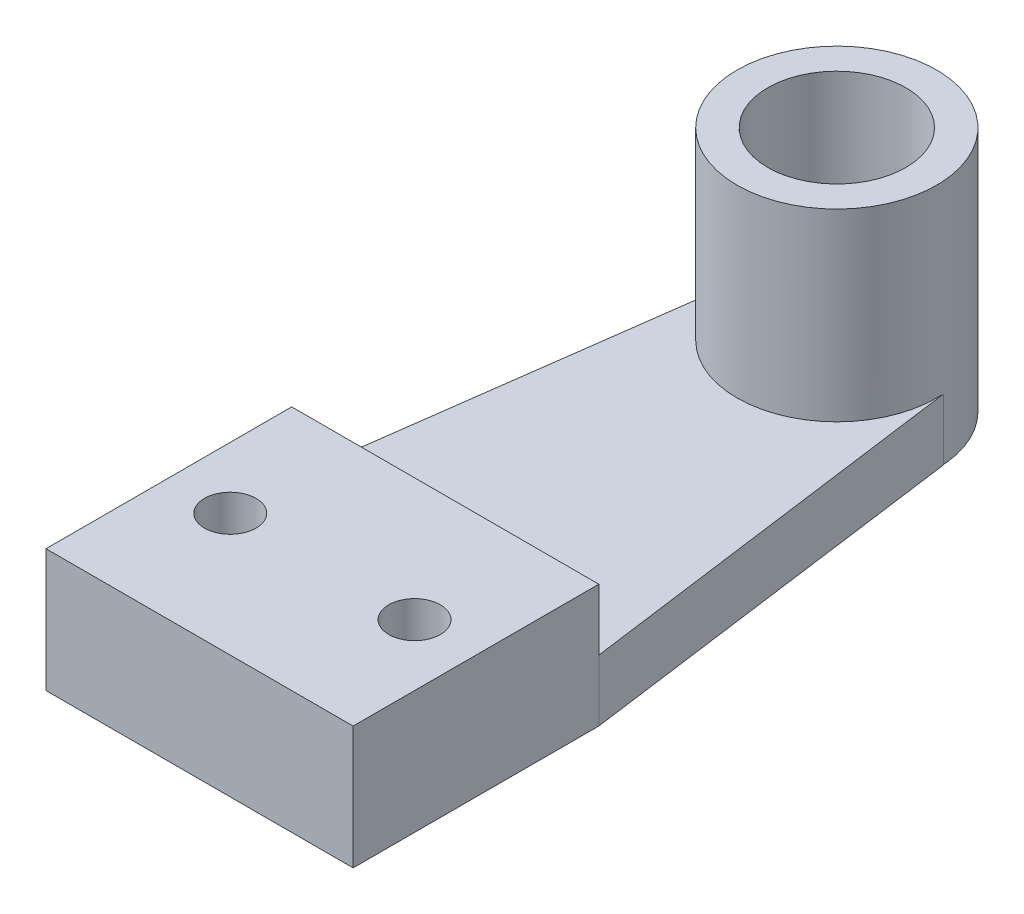
from build123d import *

# Parameters (mm, degrees)
SKETCH1_R           = 2.1
BOSS_EXTRUDE1_DEPTH = 5
SKETCH1_3_R         = 2.1
BOSS_EXTRUDE2_DEPTH = 10
SKETCH1_4_R         = 5.625
BOSS_EXTRUDE3_DEPTH = 20


with BuildPart() as part:
    # Sketch1 → Boss-Extrude1 (new body)
    with BuildSketch(Plane(origin=(0, 0, 0), x_dir=(1, 0, 0), z_dir=(0, 1, 0))):
        with BuildLine():
            Line((12.5, -10), (12.5, 10))
            Line((12.5, 10), (8.125, 42.420738715))
            Line((8.125, 42.420738715), (8.125, 41.875))
            ThreePointArc((8.125, 41.875), (0, 50), (-8.125, 41.875))
            Line((-8.125, 41.875), (-8.125, 42.420738715))
            Line((-8.125, 42.420738715), (-12.5, 10))
            Line((-12.5, 10), (-12.5, -10))
            Line((-12.5, -10), (12.5, -10))
        make_face()
        with Locations((-7.5, 0)):
            Circle(SKETCH1_R, mode=Mode.SUBTRACT)
        with Locations((7.5, 0)):
            Circle(SKETCH1_R, mode=Mode.SUBTRACT)
    extrude(amount=BOSS_EXTRUDE1_DEPTH)

    # Sketch1<3> → Boss-Extrude2 (add)
    with BuildSketch(Plane(origin=(0, 0, 0), x_dir=(1, 0, 0), z_dir=(0, 1, 0))):
        Polygon((-8.125, 10), (-12.5, 10), (-12.5, -10), (12.5, -10), (12.5, 10), (8.125, 10), align=None)
        with Locations((-7.5, 0)):
            Circle(SKETCH1_3_R, mode=Mode.SUBTRACT)
        with Locations((7.5, 0)):
            Circle(SKETCH1_3_R, mode=Mode.SUBTRACT)
    extrude(amount=BOSS_EXTRUDE2_DEPTH)

    # Sketch1<4> → Boss-Extrude3 (add)
    with BuildSketch(Plane(origin=(0, 0, 0), x_dir=(1, 0, 0), z_dir=(0, 1, 0))):
        with BuildLine():
            ThreePointArc((3.9e-08, 50), (-5.347298391, 47.992354405), (-8.05201708, 42.961575326))
            ThreePointArc((-8.05201708, 42.961575326), (-8.106733737, 42.41951181), (-8.125, 41.875))
            ThreePointArc((-8.125, 41.875), (0, 33.75), (8.125, 41.875))
            ThreePointArc((8.125, 41.875), (8.106733737, 42.41951181), (8.05201708, 42.961575326))
            ThreePointArc((8.05201708, 42.961575326), (5.34729842, 47.992354379), (3.9e-08, 50))
        make_face()
        with Locations((0, 41.875)):
            Circle(SKETCH1_4_R, mode=Mode.SUBTRACT)
    extrude(amount=BOSS_EXTRUDE3_DEPTH)


solid = part.part
